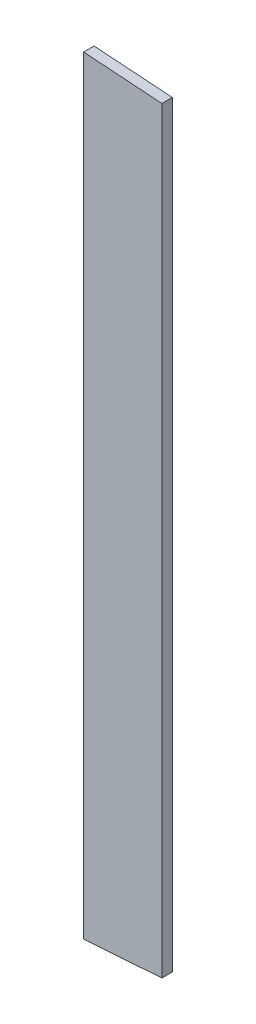
from build123d import *

# Parameters (mm, degrees)
BOSS_EXTRUDE1_DEPTH = 2


with BuildPart() as part:
    # Sketch1 → Boss-Extrude1 (new body)
    with BuildSketch(Plane.XY.offset(2463.849999999)):
        Polygon((-49.769678516, 346.108282384), (-64.769678516, 345.059380205), (-64.769678516, 492.415801833), (-49.769678516, 491.366899654), align=None)
    extrude(amount=BOSS_EXTRUDE1_DEPTH)


solid = part.part
